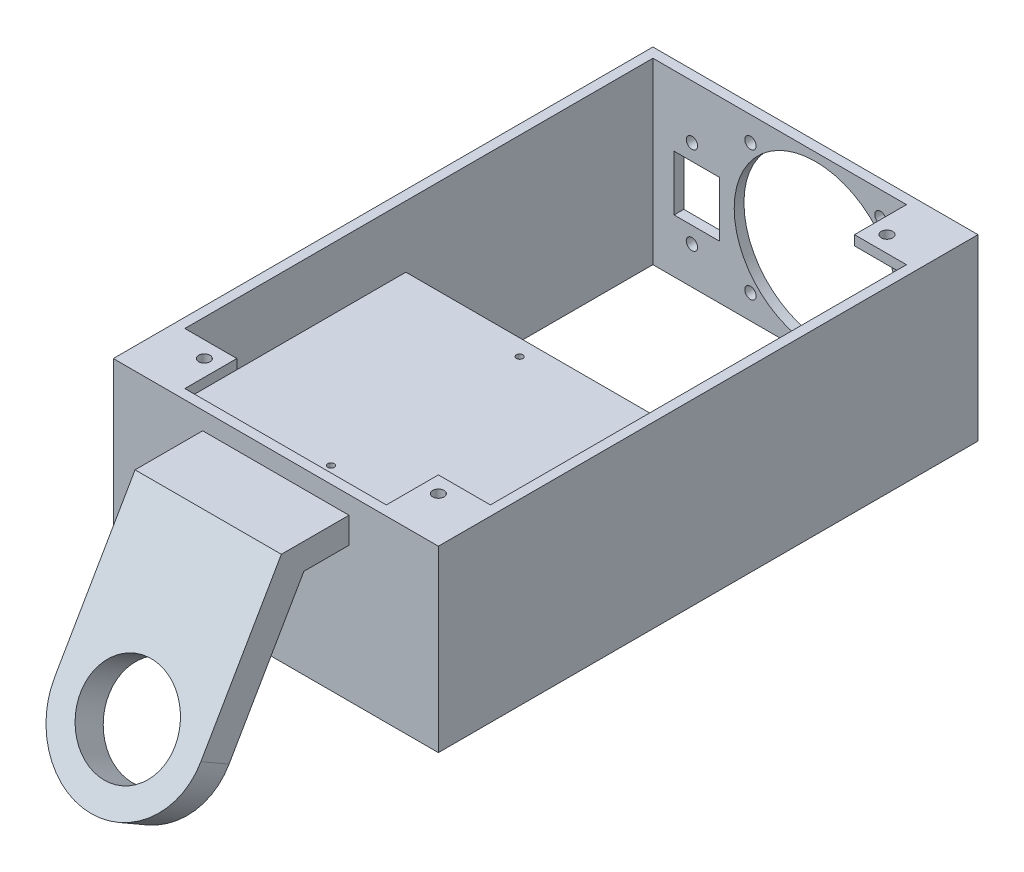
from build123d import *

# Parameters (mm, degrees)
SKETCH2_R                      = 22.5
SKETCH2_R_2                    = 14.5
USB_CHARGE_DEVICE_RING_DEPTH   = 10
RING_START                     = 70.540362552
RING_COMPLETION_DEPTH          = 10
SKETCH4_W                      = 45
SKETCH4_H                      = 23.80144284
LINK_TO_UNIT_CHASSIS_DEPTH     = 8
SKETCH5_W                      = 100
SKETCH5_H                      = 166
SKETCH5_W_2                    = 94
SKETCH5_H_2                    = 160
CHASSIS_WALLS_DEPTH            = 55
SKETCH6_W                      = 19
SKETCH6_H                      = 19
SKETCH6_R                      = 1.75
DISPLAY_FRAME_MOUNT_TABS_DEPTH = 3
SKETCH7_W                      = 94
SKETCH7_H                      = 68
SKETCH7_R                      = 1
RPI_MOUNT_SURFACE_DEPTH        = 3
SKETCH8_R                      = 3
SKETCH8_R_2                    = 1
RPI_MOUNT_BOSSES_DEPTH         = 2
F_50MM_FAN_HOLES_REACH         = 246.023
SKETCH9_R                      = 1.75
SKETCH9_R_2                    = 25
RJ45_CUTOUT_REACH              = 246.023
SKETCH10_R                     = 1.75
SKETCH10_W                     = 14
SKETCH10_H                     = 17


# Read off the part's stored shape, not the designer's step: RING COMPLETION
with BuildPart() as part:
    # Sketch2 → USB CHARGE DEVICE RING (new body)
    with BuildSketch(Plane(origin=(0, 40.270181276, 69.75), x_dir=(1, 0, 0), z_dir=(0, 0.500000000000001, 0.866025403784438))):
        with Locations(Location((0, -117.602885683, 0), (0, 0, 270))):
            Circle(SKETCH2_R)
        with Locations(Location((0, -117.602885683, 0), (0, 0, 270))):
            Circle(SKETCH2_R_2, mode=Mode.SUBTRACT)
    extrude(amount=-USB_CHARGE_DEVICE_RING_DEPTH)

    # RING COMPLETION outline → RING COMPLETION (add)
    with BuildSketch(Plane(origin=(0, 0, 0), x_dir=(1, 0, 0), z_dir=(0, 0.500000000000001, 0.866025403784438)).offset(RING_START)):
        with BuildLine():
            Line((-22.5, -68.102885683), (-22.5, -117.602885683))
            ThreePointArc((-22.5, -117.602885683), (0, -95.102885683), (22.5, -117.602885683))
            Line((22.5, -117.602885683), (22.5, -68.102885683))
            Line((22.5, -68.102885683), (-22.5, -68.102885683))
        make_face()
    extrude(amount=RING_COMPLETION_DEPTH)

    # Sketch4 → LINK TO UNIT CHASSIS (add)
    with BuildSketch(Plane(origin=(0, -18.708647797, 0), x_dir=(1, 0, 0), z_dir=(0, 1, 0))):
        with Locations((0, -91.900721421)):
            Rectangle(SKETCH4_W, SKETCH4_H)
    extrude(amount=-LINK_TO_UNIT_CHASSIS_DEPTH)

    # Sketch5 → CHASSIS WALLS (add)
    with BuildSketch(Plane(origin=(0, -13.208647797, 0), x_dir=(-1, 0, 0), z_dir=(0, -1, 0))):
        Rectangle(SKETCH5_W, SKETCH5_H)
        Rectangle(SKETCH5_W_2, SKETCH5_H_2, mode=Mode.SUBTRACT)
    extrude(amount=CHASSIS_WALLS_DEPTH)

    # Sketch6 → DISPLAY FRAME MOUNT TABS (add)
    # profile 1 of 3: a face of its own
    with BuildSketch(Plane(origin=(0, -13.208647797, 0), x_dir=(1, 0, 0), z_dir=(0, 1, 0))):
        with Locations((-40.5, -73.5)):
            Rectangle(SKETCH6_W, SKETCH6_H)
        with Locations(Location((-36, -69, 0), (0, 0, 270))):
            Circle(SKETCH6_R, mode=Mode.SUBTRACT)
    # profile 2 of 3: a face of its own
    with BuildSketch(Plane(origin=(0, -13.208647797, 0), x_dir=(1, 0, 0), z_dir=(0, 1, 0))):
        with Locations((40.5, -73.5)):
            Rectangle(SKETCH6_W, SKETCH6_H)
        with Locations(Location((36, -69, 0), (0, 0, 270))):
            Circle(SKETCH6_R, mode=Mode.SUBTRACT)
    # profile 3 of 3: a face of its own
    with BuildSketch(Plane(origin=(0, -13.208647797, 0), x_dir=(1, 0, 0), z_dir=(0, 1, 0))):
        with Locations((40.5, 73.5)):
            Rectangle(SKETCH6_W, SKETCH6_H)
        with Locations(Location((36, 69, 0), (0, 0, 270))):
            Circle(SKETCH6_R, mode=Mode.SUBTRACT)
    extrude(amount=-DISPLAY_FRAME_MOUNT_TABS_DEPTH)

    # Sketch7 → RPI MOUNT SURFACE (add)
    with BuildSketch(Plane(origin=(0, -32.208647797, 0), x_dir=(-1, 0, 0), z_dir=(0, -1, 0))):
        with Locations((0, -30.000000001)):
            Rectangle(SKETCH7_W, SKETCH7_H)
        with Locations(Location((7, -1.000000001, 0), (0, 0, 90))):
            Circle(SKETCH7_R, mode=Mode.SUBTRACT)
        with Locations(Location((-42, -1.000000001, 0), (0, 0, 90))):
            Circle(SKETCH7_R, mode=Mode.SUBTRACT)
        with Locations(Location((7, -59.000000001, 0), (0, 0, 90))):
            Circle(SKETCH7_R, mode=Mode.SUBTRACT)
        with Locations(Location((-42, -59.000000001, 0), (0, 0, 90))):
            Circle(SKETCH7_R, mode=Mode.SUBTRACT)
    extrude(amount=RPI_MOUNT_SURFACE_DEPTH)

    # Sketch8 → RPI MOUNT BOSSES (add)
    # profile 1 of 4: a face of its own
    with BuildSketch(Plane.XZ.offset(35.208647797)):
        with Locations(Location((42, 59.000000001, 0), (0, 0, 270))):
            Circle(SKETCH8_R)
        with Locations(Location((42, 59.000000001, 0), (0, 0, 270))):
            Circle(SKETCH8_R_2, mode=Mode.SUBTRACT)
    # profile 2 of 4: a face of its own
    with BuildSketch(Plane.XZ.offset(35.208647797)):
        with Locations(Location((42, 1.000000001, 0), (0, 0, 270))):
            Circle(SKETCH8_R)
        with Locations(Location((42, 1.000000001, 0), (0, 0, 270))):
            Circle(SKETCH8_R_2, mode=Mode.SUBTRACT)
    # profile 3 of 4: a face of its own
    with BuildSketch(Plane.XZ.offset(35.208647797)):
        with Locations(Location((-7, 1.000000001, 0), (0, 0, 270))):
            Circle(SKETCH8_R)
        with Locations(Location((-7, 1.000000001, 0), (0, 0, 270))):
            Circle(SKETCH8_R_2, mode=Mode.SUBTRACT)
    # profile 4 of 4: a face of its own
    with BuildSketch(Plane.XZ.offset(35.208647797)):
        with Locations(Location((-7, 59.000000001, 0), (0, 0, 270))):
            Circle(SKETCH8_R)
        with Locations(Location((-7, 59.000000001, 0), (0, 0, 270))):
            Circle(SKETCH8_R_2, mode=Mode.SUBTRACT)
    extrude(amount=RPI_MOUNT_BOSSES_DEPTH)

    # Sketch9 → 50MM FAN HOLES (cut, up to next)
    with BuildSketch(Plane(origin=(0, 0, -83), x_dir=(-1, 0, 0), z_dir=(0, 0, -1)), mode=Mode.PRIVATE) as f_50mm_fan_holes_sk1:
        with Locations((-23, -20.708647797)):
            Circle(SKETCH9_R)
    f_50mm_fan_holes_tool1 = extrude(f_50mm_fan_holes_sk1.sketch, amount=-F_50MM_FAN_HOLES_REACH, mode=Mode.PRIVATE) & part.part
    # Sketch9 → 50MM FAN HOLES (cut, up to next)
    with BuildSketch(Plane(origin=(0, 0, -83), x_dir=(-1, 0, 0), z_dir=(0, 0, -1)), mode=Mode.PRIVATE) as f_50mm_fan_holes_sk2:
        with Locations((17, -20.708647797)):
            Circle(SKETCH9_R)
    f_50mm_fan_holes_tool2 = extrude(f_50mm_fan_holes_sk2.sketch, amount=-F_50MM_FAN_HOLES_REACH, mode=Mode.PRIVATE) & part.part
    # Sketch9 → 50MM FAN HOLES (cut, up to next)
    with BuildSketch(Plane(origin=(0, 0, -83), x_dir=(-1, 0, 0), z_dir=(0, 0, -1)), mode=Mode.PRIVATE) as f_50mm_fan_holes_sk3:
        with Locations((17, -60.708647797)):
            Circle(SKETCH9_R)
    f_50mm_fan_holes_tool3 = extrude(f_50mm_fan_holes_sk3.sketch, amount=-F_50MM_FAN_HOLES_REACH, mode=Mode.PRIVATE) & part.part
    # Sketch9 → 50MM FAN HOLES (cut, up to next)
    with BuildSketch(Plane(origin=(0, 0, -83), x_dir=(-1, 0, 0), z_dir=(0, 0, -1)), mode=Mode.PRIVATE) as f_50mm_fan_holes_sk4:
        with Locations((-23, -60.708647797)):
            Circle(SKETCH9_R)
    f_50mm_fan_holes_tool4 = extrude(f_50mm_fan_holes_sk4.sketch, amount=-F_50MM_FAN_HOLES_REACH, mode=Mode.PRIVATE) & part.part
    # Sketch9 → 50MM FAN HOLES (cut, up to next)
    with BuildSketch(Plane(origin=(0, 0, -83), x_dir=(-1, 0, 0), z_dir=(0, 0, -1)), mode=Mode.PRIVATE) as f_50mm_fan_holes_sk5:
        with Locations((-3, -40.708647797)):
            Circle(SKETCH9_R_2)
    f_50mm_fan_holes_tool5 = extrude(f_50mm_fan_holes_sk5.sketch, amount=-F_50MM_FAN_HOLES_REACH, mode=Mode.PRIVATE) & part.part
    add(f_50mm_fan_holes_tool1.solids().sort_by_distance((23, -20.708648, -83))[0], mode=Mode.SUBTRACT)
    add(f_50mm_fan_holes_tool2.solids().sort_by_distance((-17, -20.708648, -83))[0], mode=Mode.SUBTRACT)
    add(f_50mm_fan_holes_tool3.solids().sort_by_distance((-17, -60.708648, -83))[0], mode=Mode.SUBTRACT)
    add(f_50mm_fan_holes_tool4.solids().sort_by_distance((23, -60.708648, -83))[0], mode=Mode.SUBTRACT)
    add(f_50mm_fan_holes_tool5.solids().sort_by_distance((3, -40.708648, -83))[0], mode=Mode.SUBTRACT)

    # Sketch10 → RJ45 CUTOUT (cut, up to next)
    with BuildSketch(Plane(origin=(0, 0, -83), x_dir=(-1, 0, 0), z_dir=(0, 0, -1)), mode=Mode.PRIVATE) as rj45_cutout_sk1:
        with Locations((35, -29.708647797)):
            Circle(SKETCH10_R)
    rj45_cutout_tool1 = extrude(rj45_cutout_sk1.sketch, amount=-RJ45_CUTOUT_REACH, mode=Mode.PRIVATE) & part.part
    # Sketch10 → RJ45 CUTOUT (cut, up to next)
    with BuildSketch(Plane(origin=(0, 0, -83), x_dir=(-1, 0, 0), z_dir=(0, 0, -1)), mode=Mode.PRIVATE) as rj45_cutout_sk2:
        with Locations((35, -56.708647797)):
            Circle(SKETCH10_R)
    rj45_cutout_tool2 = extrude(rj45_cutout_sk2.sketch, amount=-RJ45_CUTOUT_REACH, mode=Mode.PRIVATE) & part.part
    # Sketch10 → RJ45 CUTOUT (cut, up to next)
    with BuildSketch(Plane(origin=(0, 0, -83), x_dir=(-1, 0, 0), z_dir=(0, 0, -1)), mode=Mode.PRIVATE) as rj45_cutout_sk3:
        with Locations((33.5, -43.208647797)):
            Rectangle(SKETCH10_W, SKETCH10_H)
    rj45_cutout_tool3 = extrude(rj45_cutout_sk3.sketch, amount=-RJ45_CUTOUT_REACH, mode=Mode.PRIVATE) & part.part
    add(rj45_cutout_tool1.solids().sort_by_distance((-35, -29.708648, -83))[0], mode=Mode.SUBTRACT)
    add(rj45_cutout_tool2.solids().sort_by_distance((-35, -56.708648, -83))[0], mode=Mode.SUBTRACT)
    add(rj45_cutout_tool3.solids().sort_by_distance((-33.5, -43.208648, -83))[0], mode=Mode.SUBTRACT)


solid = part.part
